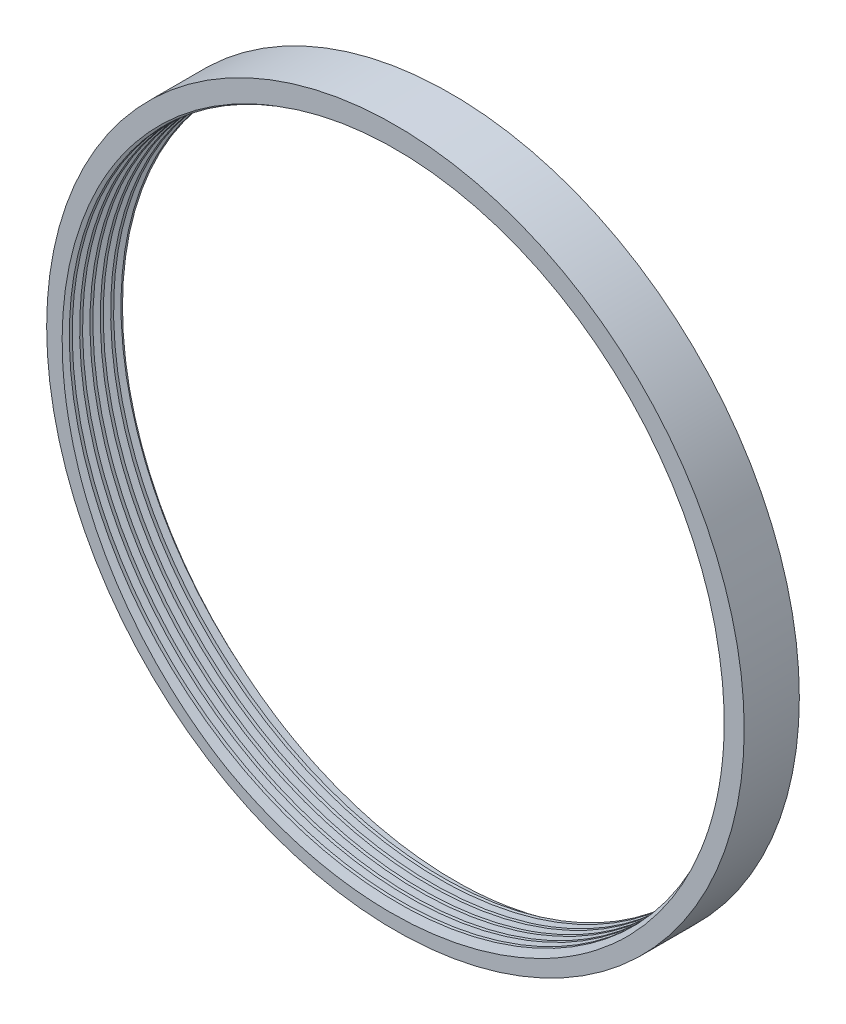
from build123d import *

# Parameters (mm, degrees)
SKETCH1_R           = 25.3
SKETCH1_R_2         = 23.8
BOSS_EXTRUDE1_DEPTH = 4
CUT_SWEEP1_PITCH    = 0.75


with BuildPart() as part:
    # Sketch1 → Boss-Extrude1 (new body)
    with BuildSketch(Plane.XY):
        Circle(SKETCH1_R)
        Circle(SKETCH1_R_2, mode=Mode.SUBTRACT)
    extrude(amount=BOSS_EXTRUDE1_DEPTH)

    # Cut-Sweep1: arcs per turn and ends read off the stored shape
    # Cut-Sweep1: the profile of Sketch9 profile screwed along a left-hand helix through 10 turns, 8 arcs to a turn; built about Z, then put on its axis
    cut_sweep1_z = Axis((0, 0, 0), (0, 0, 1))
    cut_sweep1_corners = [(23.7997, 0, -0.018457494), (23.7997, 0, 0.518457494), (24.5, 0, 0.25)]
    with BuildLine(mode=Mode.PRIVATE) as cut_sweep1_profile:
        Line(cut_sweep1_corners[0], cut_sweep1_corners[1])
        Line(cut_sweep1_corners[1], cut_sweep1_corners[2])
        Line(cut_sweep1_corners[2], cut_sweep1_corners[0])
    cut_sweep1_cap = Face(cut_sweep1_profile.wire())
    cut_sweep1_turn_angles = [0, -22.5, -45, -67.5, -90, -112.5, -135, -157.5, -180, -202.5, -225, -247.5, -270, -292.5, -315, -337.5, -360]
    cut_sweep1_turn_weights = [1, 0.9238795325112867, 1, 0.9238795325112867, 1, 0.9238795325112867, 1, 0.9238795325112867, 1, 0.9238795325112867, 1, 0.9238795325112867, 1, 0.9238795325112867, 1, 0.9238795325112867, 1]
    cut_sweep1_turn_rails = [Edge.make_bspline([Vector(p[0], p[1], 0).rotate(cut_sweep1_z, cut_sweep1_turn_angles[k]) / cut_sweep1_turn_weights[k] + Vector(0, 0, p[2] + -CUT_SWEEP1_PITCH * cut_sweep1_turn_angles[k] / 360) for k in range(17)], [0, 0, 0, 1, 1, 2, 2, 3, 3, 4, 4, 5, 5, 6, 6, 7, 7, 8, 8, 8], 2, cut_sweep1_turn_weights) for p in cut_sweep1_corners]
    cut_sweep1_turn_sides = [Face.make_surface_from_curves(cut_sweep1_turn_rails[p[0]], cut_sweep1_turn_rails[p[1]]) for p in [(0, 1), (1, 2), (2, 0)]]
    cut_sweep1 = Plane(origin=(0, 0, -1), x_dir=(1, 0, 0), z_dir=(0, 0, 1)) * Solid(Shell([*[p.moved(Location((0, 0, CUT_SWEEP1_PITCH * i))) for i in range(10) for p in cut_sweep1_turn_sides], cut_sweep1_cap, cut_sweep1_cap.rotate(cut_sweep1_z, -3600).moved(Location((0, 0, -CUT_SWEEP1_PITCH * -3600 / 360)))]))
    add(cut_sweep1, mode=Mode.SUBTRACT)


solid = part.part
